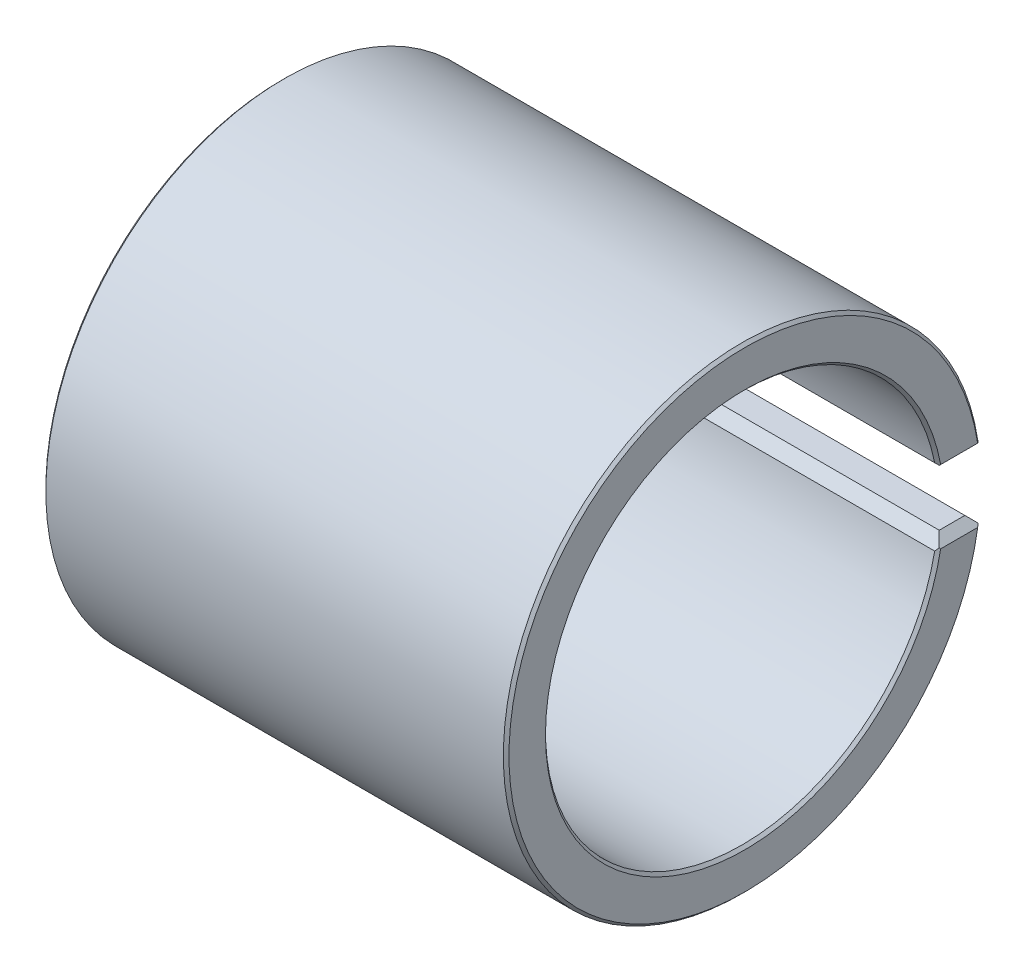
from build123d import *

# Parameters (mm, degrees)
SKETCH1_W          = 16.5
SKETCH1_H          = 1.5
CHAMFER1_SIZE      = 0.1
SKETCH2_W          = 43.906364016
SKETCH2_H          = 2
CUT_EXTRUDE1_DEPTH = 15.579523312
CHAMFER2_SIZE      = 0.3


with BuildPart() as part:
    # Sketch1 → Revolve1 (revolve)
    with BuildSketch(Plane.XY, mode=Mode.PRIVATE) as revolve1_sk:
        with Locations((0, 7.75)):
            Rectangle(SKETCH1_W, SKETCH1_H)
    revolve(revolve1_sk.sketch.rotate(Axis((0, 0, 0), (1, 0, 0)), 90), axis=Axis((0, 0, 0), (1, 0, 0)))

    # Chamfer1
    chamfer1_edges = [part.edges().sort_by_distance(p)[0] for p in [
        (-8.25, 0, -7),
        (8.25, 0, -7),
        (8.25, 0, -8.5),
        (-8.25, 0, -8.5),
    ]]
    chamfer(chamfer1_edges, length=CHAMFER1_SIZE)

    # Sketch2 → Cut-Extrude1 (cut, through all)
    with BuildSketch(Plane.XY):
        Rectangle(SKETCH2_W, SKETCH2_H)
    extrude(amount=-CUT_EXTRUDE1_DEPTH, mode=Mode.SUBTRACT)

    # Chamfer2
    # the kernel refuses this chamfer: 0.354238868, 0.3, 0.270099322 mm, written as the material it takes off along each edge
    with BuildSketch(Plane(origin=(8.25, 1, -6.257719812), x_dir=(-1, 0, 0), z_dir=(0, 0, -1)), Plane(origin=(-8.25, 1, -9.111768681), x_dir=(1, 0, 0), z_dir=(0, 0, 1)), Plane(origin=(-8.25, -1, -6.257719812), x_dir=(1, 0, 0), z_dir=(0, 0, -1))) as chamfer2_piece_1:
        Polygon((CHAMFER2_SIZE, 0), (0, CHAMFER2_SIZE), (0, 0), align=None)
    extrude(amount=2.854048869, mode=Mode.SUBTRACT)
    with BuildSketch(Plane(origin=(8.25, -1, -9.111768681), x_dir=(0, -1, 0), z_dir=(0, 0, 1))) as chamfer2_piece_2:
        Polygon((CHAMFER2_SIZE, 0), (0, -CHAMFER2_SIZE), (0, 0), align=None)
    extrude(amount=2.854048869, mode=Mode.SUBTRACT)
    with BuildSketch(Plane(origin=(8.921504896, -1, -8.440971508), x_dir=(0, 0, 1), z_dir=(-1, 0, 0))) as chamfer2_piece_3:
        with BuildLine():
            Line((CHAMFER2_SIZE, 0), (0.035547132, -0.264452868))
            ThreePointArc((0.035547132, -0.264452868), (0.01722122, -0.135971426), (0, 0))
            Line((0, 0), (CHAMFER2_SIZE, 0))
        make_face()
    extrude(amount=17.843009793, mode=Mode.SUBTRACT)
    with BuildSketch(Plane(origin=(8.921504896, 1, -8.440971508), x_dir=(0, 0, 1), z_dir=(-1, 0, 0))) as chamfer2_piece_4:
        with BuildLine():
            Line((CHAMFER2_SIZE, 0), (0.035547132, 0.264452868))
            ThreePointArc((0.035547132, 0.264452868), (0.01722122, 0.135971426), (0, 0))
            Line((0, 0), (CHAMFER2_SIZE, 0))
        make_face()
    extrude(amount=17.843009793, mode=Mode.SUBTRACT)
    with BuildSketch(Plane(origin=(-9.097260331, -1, -6.92820323), x_dir=(0, 0, -1), z_dir=(1, 0, 0))) as chamfer2_piece_5:
        with BuildLine():
            Line((CHAMFER2_SIZE, 0), (-0.061980996, -0.361980996))
            ThreePointArc((-0.061980996, -0.361980996), (-0.029595535, -0.187102296), (0, 0))
            Line((0, 0), (CHAMFER2_SIZE, 0))
        make_face()
    extrude(amount=18.194520662, mode=Mode.SUBTRACT)
    with BuildSketch(Plane(origin=(-9.097260331, 1, -6.92820323), x_dir=(0, 0.9856552884232092, 0.16877100581367702), z_dir=(1, 0, 0))) as chamfer2_piece_6:
        with BuildLine():
            Line((0.367249078, 0), (-CHAMFER2_SIZE * 0.168771005814, -CHAMFER2_SIZE * 0.985655288423))
            Line((-CHAMFER2_SIZE * 0.168771005814, -CHAMFER2_SIZE * 0.985655288423), (0, 0))
            ThreePointArc((0, 0), (0.189413236, -0.002406447), (0.367249078, 0))
        make_face()
    extrude(amount=18.194520662, mode=Mode.SUBTRACT)


solid = part.part
